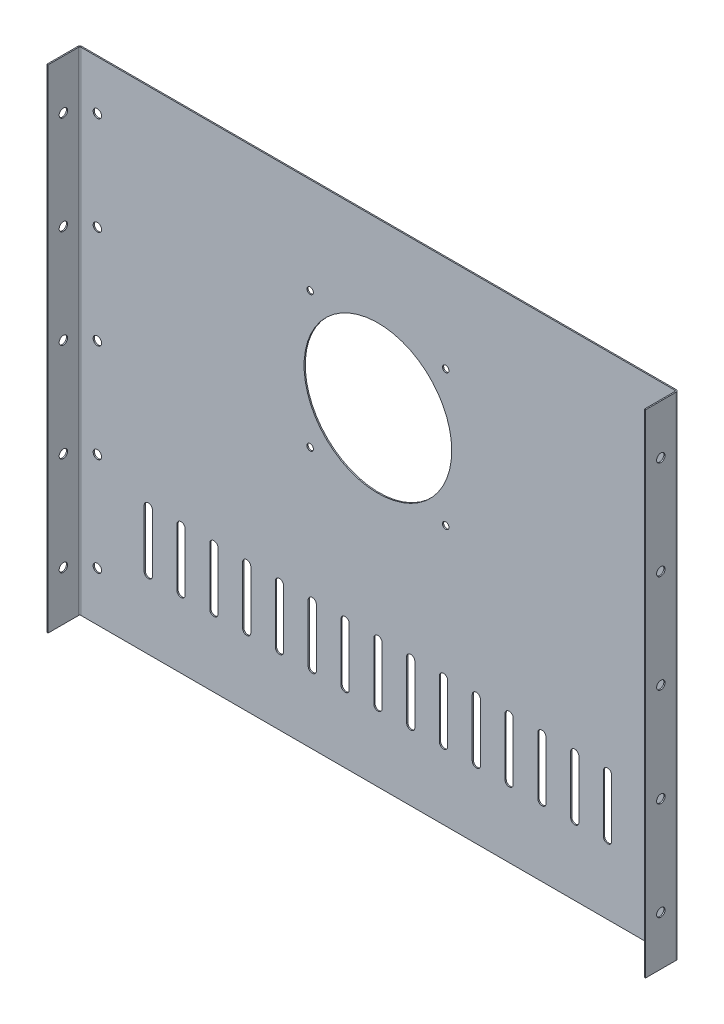
from build123d import *

# Parameters (mm, degrees)
SKETCH1_W                       = 461.66024
SKETCH1_H                       = 381
BOSS_EXTRUDE1_DEPTH             = 0.9144
EDGE_FLANGE1_STRIP_W            = 5.4864
EDGE_FLANGE1_STRIP_H            = 0.9144
EDGE_FLANGE1_STRIP_CUT_DEPTH    = 381
EDGE_FLANGE1_DEPTH              = 381
EDGE_FLANGE2_STRIP_W            = 5.4864
EDGE_FLANGE2_STRIP_H            = 0.9144
EDGE_FLANGE2_STRIP_CUT_DEPTH    = 381
EDGE_FLANGE2_DEPTH              = 381
F_0_257_DIAMETER_HOLE1_D        = 6.5278
F_0_257_DIAMETER_HOLE2_D        = 6.5278
SKETCH17_R                      = 57.15
CUT_EXTRUDE1_DEPTH              = 301.990559914
F_5_0_5_DIAMETER_HOLE1_D        = 5
F_1_4_0_25_DIAMETER_SLOT1_DEPTH = 0.9144
LPATTERN1_COUNT                 = 8
LPATTERN1_PITCH                 = 25.4
LPATTERN1_COL_COUNT             = 8
LPATTERN1_COL_PITCH             = 25.4


# Read off the part's stored shape, not the designer's step: 1/4 (0.25) Diameter Slot1
# Sheet-metal steps are written as plain solids
with BuildPart() as part:
    # Sketch1 → Boss-Extrude1 (new body)
    with BuildSketch(Plane.XY):
        Rectangle(SKETCH1_W, SKETCH1_H)
    extrude(amount=BOSS_EXTRUDE1_DEPTH)

    # Edge-Flange1 strip (across the edge) → Edge-Flange1 strip cut (cut)
    with BuildSketch(Plane(origin=(230.83012, -190.5, 0.9144), x_dir=(-1, 0, 0), z_dir=(0, 1, 0))):
        with Locations((-1.8288, -0.4572)):
            Rectangle(EDGE_FLANGE1_STRIP_W, EDGE_FLANGE1_STRIP_H)
    extrude(amount=EDGE_FLANGE1_STRIP_CUT_DEPTH, mode=Mode.SUBTRACT)

    # Edge-Flange1 section (across the edge) → Edge-Flange1 (add)
    with BuildSketch(Plane(origin=(230.83012, -190.5, 0.9144), x_dir=(-1, 0, 0), z_dir=(0, 1, 0))):
        with BuildLine():
            Line((-0.9144, 0.9144), (-0.9144, 24.4856))
            Line((-0.9144, 24.4856), (0, 24.4856))
            Line((0, 24.4856), (0, 0.9144))
            ThreePointArc((0, 0.9144), (0.267821559, 0.267821559), (0.9144, 0))
            Line((0.9144, 0), (0.9144, -0.9144))
            ThreePointArc((0.9144, -0.9144), (-0.378756881, -0.378756881), (-0.9144, 0.9144))
        make_face()
    extrude(amount=EDGE_FLANGE1_DEPTH)

    # Edge-Flange2 strip (across the edge) → Edge-Flange2 strip cut (cut)
    with BuildSketch(Plane(origin=(-230.83012, 190.5, 0.9144), x_dir=(1, 0, 0), z_dir=(0, -1, 0))):
        with Locations((-1.8288, -0.4572)):
            Rectangle(EDGE_FLANGE2_STRIP_W, EDGE_FLANGE2_STRIP_H)
    extrude(amount=EDGE_FLANGE2_STRIP_CUT_DEPTH, mode=Mode.SUBTRACT)

    # Edge-Flange2 section (across the edge) → Edge-Flange2 (add)
    with BuildSketch(Plane(origin=(-230.83012, 190.5, 0.9144), x_dir=(1, 0, 0), z_dir=(0, -1, 0))):
        with BuildLine():
            Line((-0.9144, 0.9144), (-0.9144, 24.4856))
            Line((-0.9144, 24.4856), (0, 24.4856))
            Line((0, 24.4856), (0, 0.9144))
            ThreePointArc((0, 0.9144), (0.267821559, 0.267821559), (0.9144, 0))
            Line((0.9144, 0), (0.9144, -0.9144))
            ThreePointArc((0.9144, -0.9144), (-0.378756881, -0.378756881), (-0.9144, 0.9144))
        make_face()
    extrude(amount=EDGE_FLANGE2_DEPTH)

    # F (0.257) Diameter Hole1 (through all)
    with Locations(Plane.ZY.offset(231.74452)):
        with Locations((13.6144, 76.2), (13.6144, 0), (13.6144, -76.2), (13.6144, -152.4), (13.6144, 152.4)):
            Hole(F_0_257_DIAMETER_HOLE1_D / 2)

    # F (0.257) Diameter Hole2 (through all)
    with Locations(Plane(origin=(0, 0, 0), x_dir=(-1, 0, 0), z_dir=(0, 0, -1))):
        with Locations((217.21572, 152.4), (-217.21572, 152.4), (-217.21572, 76.2), (-217.21572, 0), (-217.21572, -76.2), (-217.21572, -152.4), (217.21572, -152.4), (217.21572, -76.2), (217.21572, 0), (217.21572, 76.2)):
            Hole(F_0_257_DIAMETER_HOLE2_D / 2)

    # Sketch17 → Cut-Extrude1 (cut, through all)
    with BuildSketch(Plane.XY.offset(0.9144)):
        with Locations((0, 63.5)):
            Circle(SKETCH17_R)
    extrude(amount=-CUT_EXTRUDE1_DEPTH, mode=Mode.SUBTRACT)

    # Ø5.0 (5) Diameter Hole1 (through all)
    with Locations(Plane.XY.offset(0.9144)):
        with Locations((0, 63.5), (52.5, 116), (-52.5, 11), (-52.5, 116), (52.5, 11)):
            Hole(F_5_0_5_DIAMETER_HOLE1_D / 2)

    # 1/4 (0.25) Diameter Slot1 outline → 1/4 (0.25) Diameter Slot1 (cut)
    with BuildSketch(Plane.XY):
        with BuildLine():
            Line((3.175, -136.525), (3.175, -92.075))
            ThreePointArc((3.175, -92.075), (0, -88.9), (-3.175, -92.075))
            Line((-3.175, -92.075), (-3.175, -136.525))
            ThreePointArc((-3.175, -136.525), (0, -139.7), (3.175, -136.525))
        make_face()
    f_1_4_0_25_diameter_slot1 = extrude(amount=F_1_4_0_25_DIAMETER_SLOT1_DEPTH, mode=Mode.SUBTRACT)

    # LPattern1: 1/4 (0.25) Diameter Slot1 ×8
    with Locations(*[(-i * LPATTERN1_PITCH, 0, 0) for i in range(1, LPATTERN1_COUNT)]):
        add(f_1_4_0_25_diameter_slot1, mode=Mode.SUBTRACT)

    # LPattern1 col: 1/4 (0.25) Diameter Slot1 ×8
    with Locations(*[(i * LPATTERN1_COL_PITCH, 0, 0) for i in range(1, LPATTERN1_COL_COUNT)]):
        add(f_1_4_0_25_diameter_slot1, mode=Mode.SUBTRACT)


solid = part.part
